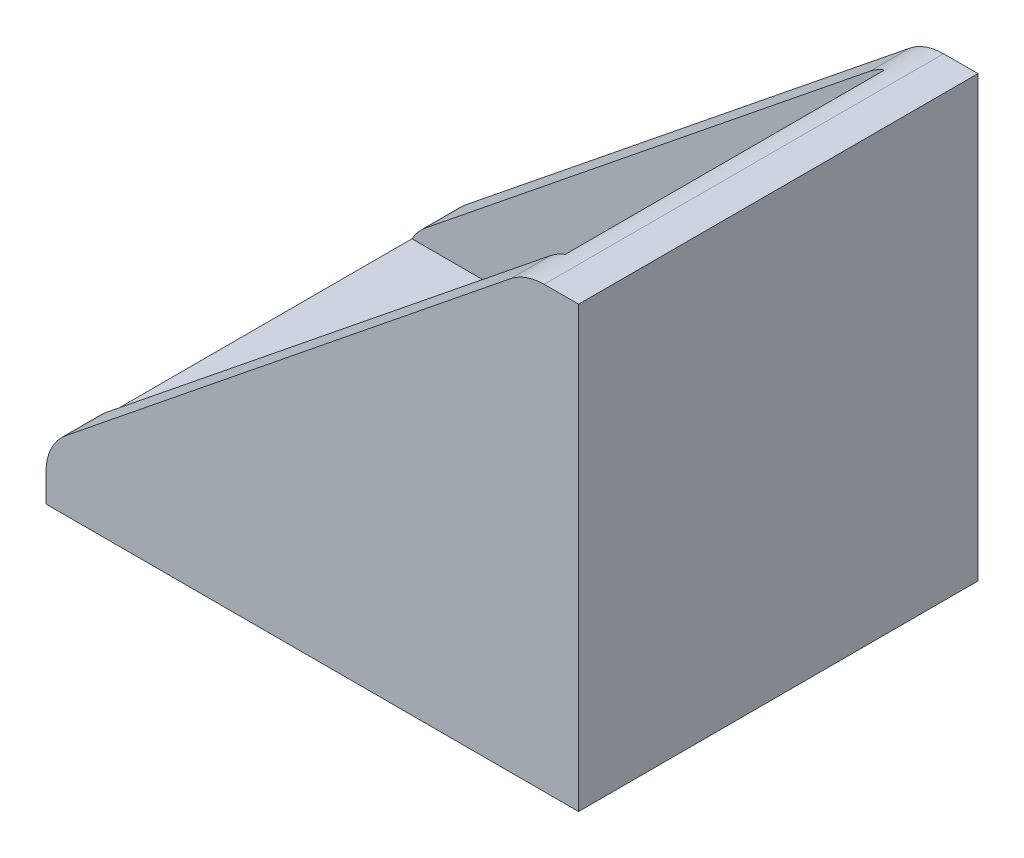
from build123d import *

# Parameters (mm, degrees)
BOSS_EXTRUDE1_DEPTH = 38.1
BOSS_EXTRUDE2_DEPTH = 3.81
FILLET3_START       = -1
FILLET3_DEPTH       = 40
CUT_EXTRUDE1_REACH  = 75.408


with BuildPart() as part:
    # Sketch1 → Boss-Extrude1 (new body)
    with BuildSketch(Plane.XY):
        Polygon((-50.8, 0), (0, 0), (0, 41.91), (-5.08, 41.91), (-5.08, 5.08), (-50.8, 5.08), align=None)
    extrude(amount=BOSS_EXTRUDE1_DEPTH)

    # Sketch6 → Boss-Extrude2 (add)
    with BuildSketch(Plane.XY):
        Polygon((-50.8, 5.08), (-5.08, 5.08), (-5.08, 41.91), align=None)
    boss_extrude2 = extrude(amount=BOSS_EXTRUDE2_DEPTH)

    # Mirror1: Boss-Extrude2 across plane
    add(boss_extrude2.mirror(Plane.XY.offset(19.05)))

    # Fillet3: read off the stored shape, not the designer's step
    # Fillet3 outline → Fillet3 (cut)
    with BuildSketch(Plane.XY.offset(FILLET3_START)):
        with BuildLine():
            Line((-48.906834052, 6.605050347), (-50.8, 5.08))
            Line((-50.8, 5.08), (-50.8, 2.648980489))
            ThreePointArc((-50.8, 2.648980489), (-50.30233112, 4.841841977), (-48.906834052, 6.605050347))
        make_face()
        with BuildLine():
            Line((-5.08, 41.91), (-6.475223624, 40.786069858))
            ThreePointArc((-6.475223624, 40.786069858), (-4.977999752, 41.620784637), (-3.288389572, 41.91))
            Line((-3.288389572, 41.91), (-5.08, 41.91))
        make_face()
    extrude(amount=FILLET3_DEPTH, mode=Mode.SUBTRACT)

    # Sketch2 → Cut-Extrude1 (cut, up to next)
    with BuildSketch(Plane(origin=(0, 5.08, 0), x_dir=(1, 0, 0), z_dir=(0, 1, 0)), mode=Mode.PRIVATE) as cut_extrude1_sk1:
        with BuildLine():
            Line((-40.33027712, -15.875), (-14.93027712, -15.875))
            ThreePointArc((-14.93027712, -15.875), (-11.75527712, -19.05), (-14.93027712, -22.225))
            Line((-14.93027712, -22.225), (-40.33027712, -22.225))
            ThreePointArc((-40.33027712, -22.225), (-43.50527712, -19.05), (-40.33027712, -15.875))
        make_face()
    cut_extrude1_tool1 = extrude(cut_extrude1_sk1.sketch, amount=-CUT_EXTRUDE1_REACH, mode=Mode.PRIVATE) & part.part
    add(cut_extrude1_tool1.solids().sort_by_distance((-27.630277, 5.08, 19.05))[0], mode=Mode.SUBTRACT)


solid = part.part
